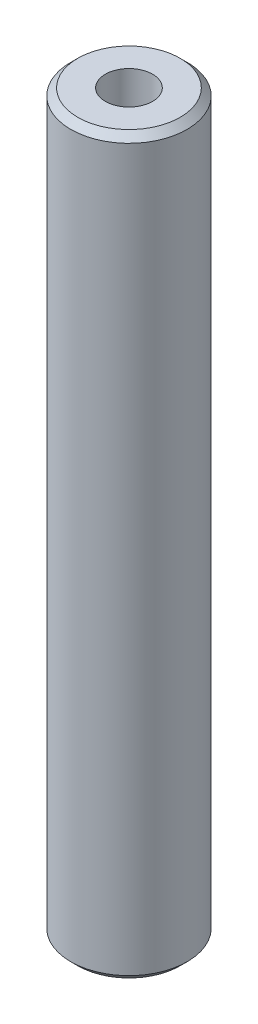
from build123d import *

# Parameters (mm, degrees)
SKETCH1_R           = 47.5
BOSS_EXTRUDE1_DEPTH = 600
SKETCH2_R           = 19.279282428
CUT_EXTRUDE1_DEPTH  = 604.748706003
CHAMFER1_SIZE       = 5.697691207


with BuildPart() as part:
    # Sketch1 → Boss-Extrude1 (new body)
    with BuildSketch(Plane(origin=(0, 0, 0), x_dir=(1, 0, 0), z_dir=(0, 1, 0))):
        Circle(SKETCH1_R)
    extrude(amount=BOSS_EXTRUDE1_DEPTH)

    # Sketch2 → Cut-Extrude1 (cut, through all)
    with BuildSketch(Plane(origin=(0, 0, 0), x_dir=(1, 0, 0), z_dir=(0, 1, 0))):
        Circle(SKETCH2_R)
    extrude(amount=CUT_EXTRUDE1_DEPTH, mode=Mode.SUBTRACT)

    # Chamfer1
    chamfer1_edges = [part.edges().sort_by_distance(p)[0] for p in [
        (-47.5, 600, 0),
        (-47.5, 0, 0),
    ]]
    chamfer(chamfer1_edges, length=CHAMFER1_SIZE)


solid = part.part
